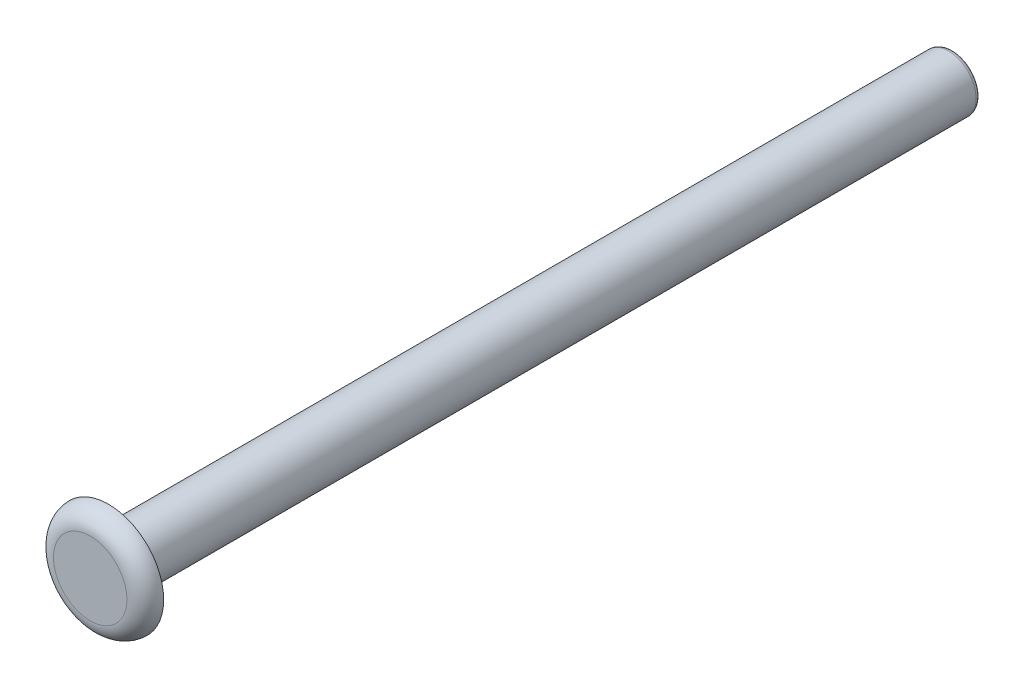
from build123d import *

# Parameters (mm, degrees)
ESQUISSE1_R        = 1.5
BOSS_EXTRU_1_DEPTH = 46
ESQUISSE2_R        = 3
BOSS_EXTRU_2_DEPTH = 1
CONG_1_R           = 1
CONG_2_R           = 0.25


with BuildPart() as part:
    # Esquisse1 → Boss.-Extru.1 (new body)
    with BuildSketch(Plane.XY):
        with Locations((-28.068256791, 21.884700983)):
            Circle(ESQUISSE1_R)
    extrude(amount=BOSS_EXTRU_1_DEPTH)

    # Esquisse2 → Boss.-Extru.2 (add)
    with BuildSketch(Plane.XY.offset(46)):
        with Locations((-28.068256791, 21.884700983)):
            Circle(ESQUISSE2_R)
    extrude(amount=BOSS_EXTRU_2_DEPTH)

    # Congé1
    cong_1_edges = [part.edges().sort_by_distance(p)[0] for p in [
        (-31.068256791, 21.884700983, 47),
    ]]
    fillet(cong_1_edges, radius=CONG_1_R - 0.0001)  # a hair under: the kernel refuses the full size

    # Congé2
    cong_2_edges = [part.edges().sort_by_distance(p)[0] for p in [
        (-29.568256791, 21.884700983, 0),
    ]]
    fillet(cong_2_edges, radius=CONG_2_R)


solid = part.part
